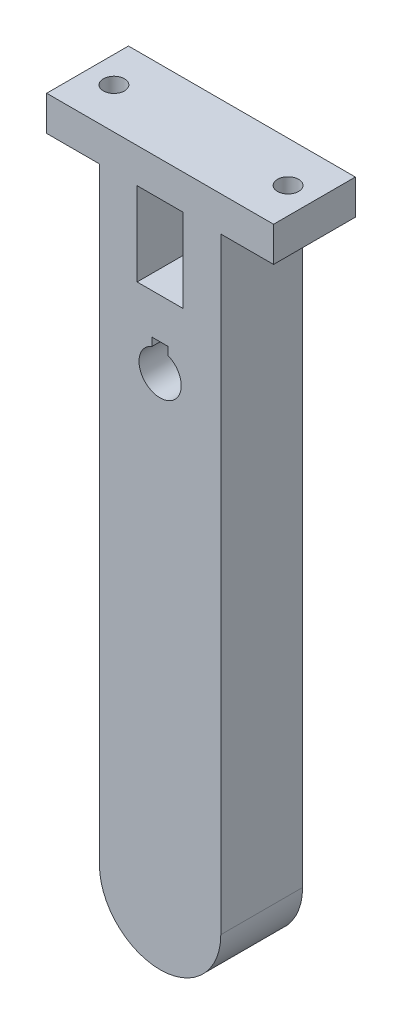
from build123d import *

# Parameters (mm, degrees)
ESTRUSIONE_ESTRUSIONE1_DEPTH = 15.5
SCHIZZO7_W                   = 8.7
SCHIZZO7_H                   = 15.8
TAGLIO_ESTRUSIONE4_DEPTH     = 15.5
TAGLIO_ESTRUSIONE5_DEPTH     = 15.5
SCHIZZO9_R                   = 2
TAGLIO_ESTRUSIONE7_DEPTH     = 6.6
SCHIZZO11_R                  = 2
TAGLIO_ESTRUSIONE8_DEPTH     = 6.6


with BuildPart() as part:
    # Schizzo3 → Estrusione-Estrusione1 (new body)
    with BuildSketch(Plane.XY):
        with BuildLine():
            Line((-62.60213075, -3.859058403), (-62.60213075, 111.140941597))
            Line((-62.60213075, 111.140941597), (-72.60213075, 111.140941597))
            Line((-72.60213075, 111.140941597), (-72.60213075, 117.740941597))
            Line((-72.60213075, 117.740941597), (-29.60213075, 117.740941597))
            Line((-29.60213075, 117.740941597), (-29.60213075, 111.140941597))
            Line((-29.60213075, 111.140941597), (-39.60213075, 111.140941597))
            Line((-39.60213075, 111.140941597), (-39.60213075, -3.859058403))
            ThreePointArc((-39.60213075, -3.859058403), (-51.10213075, -15.359058403), (-62.60213075, -3.859058403))
        make_face()
    extrude(amount=ESTRUSIONE_ESTRUSIONE1_DEPTH)

    # Schizzo7 → Taglio-Estrusione4 (cut)
    with BuildSketch(Plane.XY):
        with Locations((-51.10213075, 103.240941597)):
            Rectangle(SCHIZZO7_W, SCHIZZO7_H)
    extrude(amount=TAGLIO_ESTRUSIONE4_DEPTH, mode=Mode.SUBTRACT)

    # Schizzo6 → Taglio-Estrusione5 (cut)
    with BuildSketch(Plane.XY):
        with BuildLine():
            Line((-49.60213075, 86.199040841), (-49.60213075, 87.699040841))
            Line((-49.60213075, 87.699040841), (-52.60213075, 87.699040841))
            Line((-52.60213075, 87.699040841), (-52.60213075, 86.199040841))
            ThreePointArc((-52.60213075, 86.199040841), (-51.10213075, 78.490941597), (-49.60213075, 86.199040841))
        make_face()
    extrude(amount=TAGLIO_ESTRUSIONE5_DEPTH, mode=Mode.SUBTRACT)

    # Schizzo9 → Taglio-Estrusione7 (cut)
    with BuildSketch(Plane.XZ.offset(-111.140941597)):
        with Locations((-67.60213075, 7.75)):
            Circle(SCHIZZO9_R)
    extrude(amount=-TAGLIO_ESTRUSIONE7_DEPTH, mode=Mode.SUBTRACT)

    # Schizzo11 → Taglio-Estrusione8 (cut)
    with BuildSketch(Plane(origin=(0, 111.140941597, 0), x_dir=(-1, 0, 0), z_dir=(0, -1, 0))):
        with Locations((34.60213075, -7.75)):
            Circle(SCHIZZO11_R)
    extrude(amount=-TAGLIO_ESTRUSIONE8_DEPTH, mode=Mode.SUBTRACT)


solid = part.part
